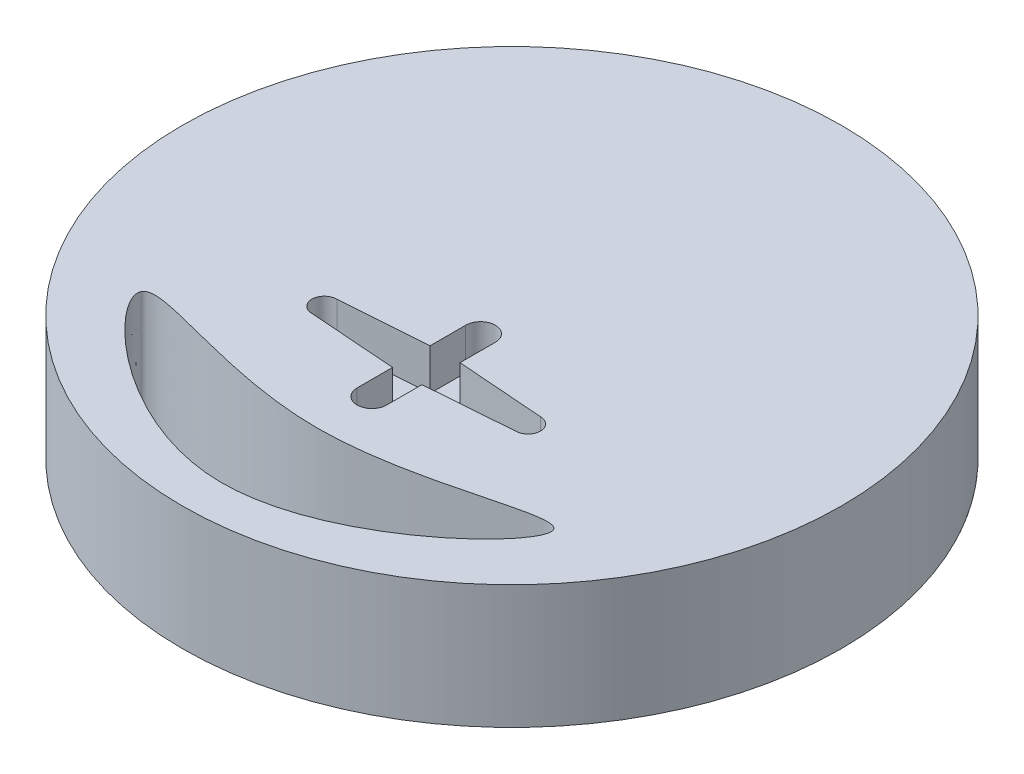
from build123d import *

# Parameters (mm, degrees)
SKETCH1_R           = 50.8
BOSS_EXTRUDE1_DEPTH = 19.05
CUT_EXTRUDE1_DEPTH  = 6.35
CUT_EXTRUDE2_DEPTH  = 75.324844433
BOSS_EXTRUDE2_DEPTH = 19.05
BOSS_EXTRUDE2_DRAFT = 25
SKETCH6_R           = 7.62
CUT_EXTRUDE3_DEPTH  = 75.324844595


with BuildPart() as part:
    # Sketch1 → Boss-Extrude1 (new body)
    with BuildSketch(Plane(origin=(0, 0, 0), x_dir=(1, 0, 0), z_dir=(0, 1, 0))):
        Circle(SKETCH1_R)
    extrude(amount=BOSS_EXTRUDE1_DEPTH)

    # Sketch2 → Cut-Extrude1 (cut)
    with BuildSketch(Plane(origin=(0, 19.05, 0), x_dir=(1, 0, 0), z_dir=(0, 1, 0))):
        with BuildLine():
            Line((-15.6972, -11.290296429), (-2.281933688, -10.319915476))
            Line((-2.281933688, -10.319915476), (-2.281933688, -4.830552162))
            ThreePointArc((-2.281933688, -4.830552162), (0, -2.548618474), (2.281933688, -4.830552162))
            Line((2.281933688, -4.830552162), (2.281933688, -10.27350561))
            Line((2.281933688, -10.27350561), (15.6972, -11.290296429))
            ThreePointArc((15.6972, -11.290296429), (17.614394741, -13.20749117), (15.6972, -15.124685911))
            Line((15.6972, -15.124685911), (2.281933688, -16.141476731))
            Line((2.281933688, -16.141476731), (2.281933688, -21.584430178))
            ThreePointArc((2.281933688, -21.584430178), (0, -23.866363866), (-2.281933688, -21.584430178))
            Line((-2.281933688, -21.584430178), (-2.281933688, -16.095066864))
            Line((-2.281933688, -16.095066864), (-15.6972, -15.124685911))
            ThreePointArc((-15.6972, -15.124685911), (-17.614394741, -13.20749117), (-15.6972, -11.290296429))
        make_face()
    extrude(amount=-CUT_EXTRUDE1_DEPTH, mode=Mode.SUBTRACT)

    # Sketch3 → Cut-Extrude2 (cut, through all)
    with BuildSketch(Plane(origin=(0, 19.05, 0), x_dir=(1, 0, 0), z_dir=(0, 1, 0))):
        with BuildLine():
            add(Edge.make_bspline(
                [(-31.75, -25.323325498), (-33.428426621, -28.350329476), (0, -61.001077706), (47.854748089, -14.259621723), (0, -37.299148342), (-30.301321469, -22.710666938), (-31.75, -25.323325498)],
                knots=[0, 0, 0, 0, 0.268367474, 0.536734948, 0.768367474, 1, 1, 1, 1], degree=3))
        make_face()
    extrude(amount=-CUT_EXTRUDE2_DEPTH, mode=Mode.SUBTRACT)


with BuildPart() as body_2:
    # Sketch4 → Boss-Extrude2 (with draft: the straight prism first)
    with BuildSketch(Plane.XZ):
        with BuildLine():
            ThreePointArc((-44.437877263, -24.615342053), (0, -50.8), (44.437877263, -24.615342053))
            Line((44.437877263, -24.615342053), (25.387877263, -24.615342053))
            Line((25.387877263, -24.615342053), (25.387877263, 1.789736865))
            Line((25.387877263, 1.789736865), (-25.387877263, 1.789736865))
            Line((-25.387877263, 1.789736865), (-25.387877263, -24.615342053))
            Line((-25.387877263, -24.615342053), (-44.437877263, -24.615342053))
        make_face()
    extrude(amount=BOSS_EXTRUDE2_DEPTH)
    # Boss-Extrude2: the draft: its side faces are tilted about the plane it starts from
    boss_extrude2_sides = [body_2.faces().sort_by_distance(p)[0] for p in [
        (0, -9.525, -50.8),
        (34.912877263, -9.525, -24.615342053),
        (25.387877263, -9.525, -11.412802594),
        (0, -9.525, 1.789736865),
        (-25.387877263, -9.525, -11.412802594),
        (-34.912877263, -9.525, -24.615342053),
    ]]
    draft(boss_extrude2_sides, Plane.XZ, BOSS_EXTRUDE2_DRAFT)

    # Sketch6 → Cut-Extrude3 (cut, through all)
    with BuildSketch(Plane.XY):
        with Locations((0, -10.16)):
            Circle(SKETCH6_R)
    extrude(amount=-CUT_EXTRUDE3_DEPTH, mode=Mode.SUBTRACT)


solid = Compound([part.part, body_2.part])
